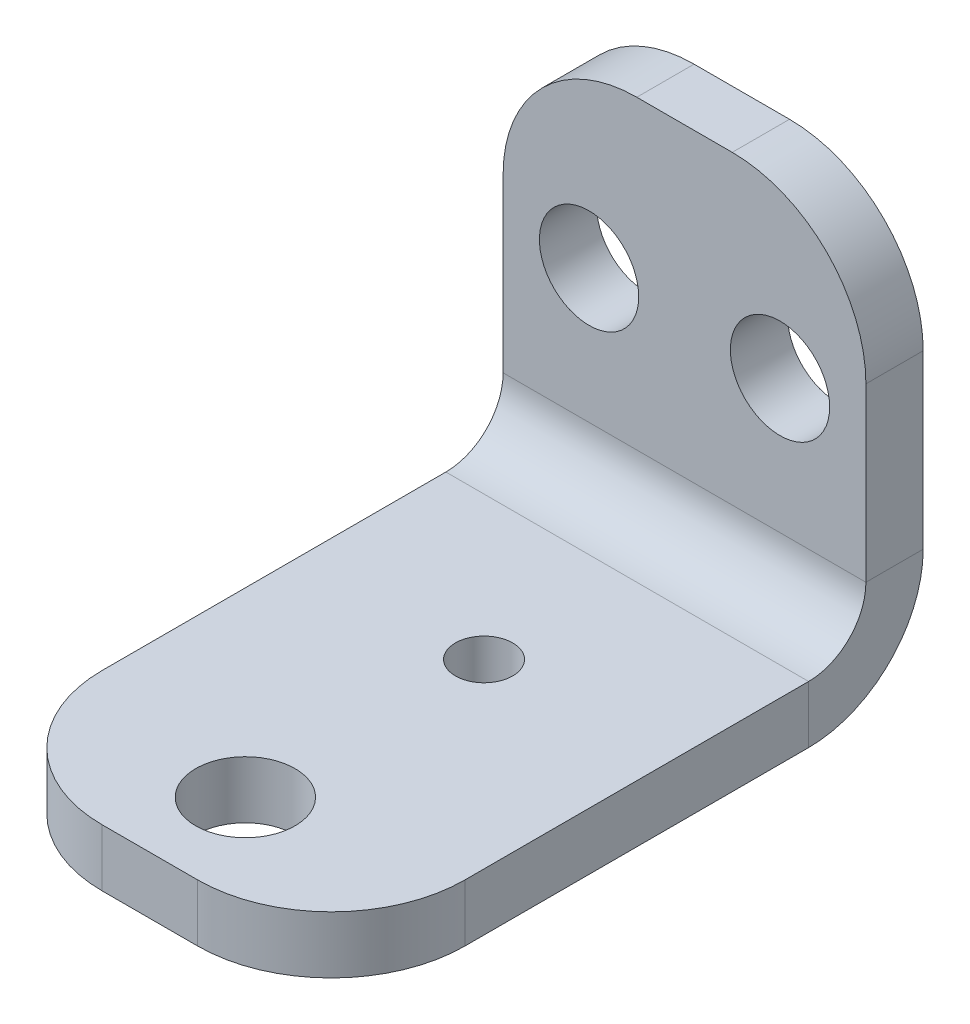
from build123d import *

# Parameters (mm, degrees)
SKETCH1_W                    = 19
SKETCH1_H                    = 22
BASE_FLANGE1_DEPTH           = 3
EDGE_FLANGE1_STRIP_W         = 18
EDGE_FLANGE1_STRIP_H         = 3
EDGE_FLANGE1_STRIP_CUT_DEPTH = 19
EDGE_FLANGE1_DEPTH           = 19
SKETCH12_R                   = 2.6
CUT_EXTRUDE1_DEPTH           = 10
SKETCH13_R                   = 2.6
CUT_EXTRUDE2_DEPTH           = 36.146123542
FILLET1_R                    = 7
SKETCH14_R                   = 1.5
CUT_EXTRUDE3_DEPTH           = 36.146123542


# Sheet-metal steps are written as plain solids
with BuildPart() as part:
    # Sketch1 → Base-Flange1 (new body)
    with BuildSketch(Plane.XY):
        Rectangle(SKETCH1_W, SKETCH1_H)
    extrude(amount=-BASE_FLANGE1_DEPTH)

    # Edge-Flange1 strip (across the edge) → Edge-Flange1 strip cut (cut)
    with BuildSketch(Plane(origin=(-9.5, -11, 0), x_dir=(0, 1, 0), z_dir=(1, 0, 0))):
        with Locations((-3, -1.5)):
            Rectangle(EDGE_FLANGE1_STRIP_W, EDGE_FLANGE1_STRIP_H)
    extrude(amount=EDGE_FLANGE1_STRIP_CUT_DEPTH, mode=Mode.SUBTRACT)

    # Edge-Flange1 section (across the edge) → Edge-Flange1 (add)
    with BuildSketch(Plane(origin=(-9.5, -11, 0), x_dir=(0, 1, 0), z_dir=(1, 0, 0))):
        with BuildLine():
            Line((0, 3), (0, 28))
            Line((0, 28), (3, 28))
            Line((3, 28), (3, 3))
            ThreePointArc((3, 3), (3.878679656, 0.878679656), (6, 0))
            Line((6, 0), (6, -3))
            ThreePointArc((6, -3), (1.757359313, -1.242640687), (0, 3))
        make_face()
    extrude(amount=EDGE_FLANGE1_DEPTH)

    # Sketch12 → Cut-Extrude1 (cut)
    with BuildSketch(Plane.XY):
        with Locations((5, 2)):
            Circle(SKETCH12_R)
        with Locations((-5, 2)):
            Circle(SKETCH12_R)
    extrude(amount=-CUT_EXTRUDE1_DEPTH, mode=Mode.SUBTRACT)

    # Sketch13 → Cut-Extrude2 (cut, through all)
    with BuildSketch(Plane(origin=(0, -8, 0), x_dir=(1, 0, 0), z_dir=(0, 1, 0))):
        with Locations(Location((0, -23, 0), (0, 0, 270))):
            Circle(SKETCH13_R)
    extrude(amount=-CUT_EXTRUDE2_DEPTH, mode=Mode.SUBTRACT)

    # Fillet1
    fillet1_edges = [part.edges().sort_by_distance(p)[0] for p in [
        (-9.5, -9.5, 28),
        (9.5, -9.5, 28),
        (-9.5, 11, -1.5),
        (9.5, 11, -1.5),
    ]]
    fillet(fillet1_edges, radius=FILLET1_R)

    # Sketch14 → Cut-Extrude3 (cut, through all)
    with BuildSketch(Plane(origin=(0, -8, 0), x_dir=(1, 0, 0), z_dir=(0, 1, 0))):
        with Locations(Location((0, -10.5, 0), (0, 0, 270))):
            Circle(SKETCH14_R)
    extrude(amount=-CUT_EXTRUDE3_DEPTH, mode=Mode.SUBTRACT)


solid = part.part
